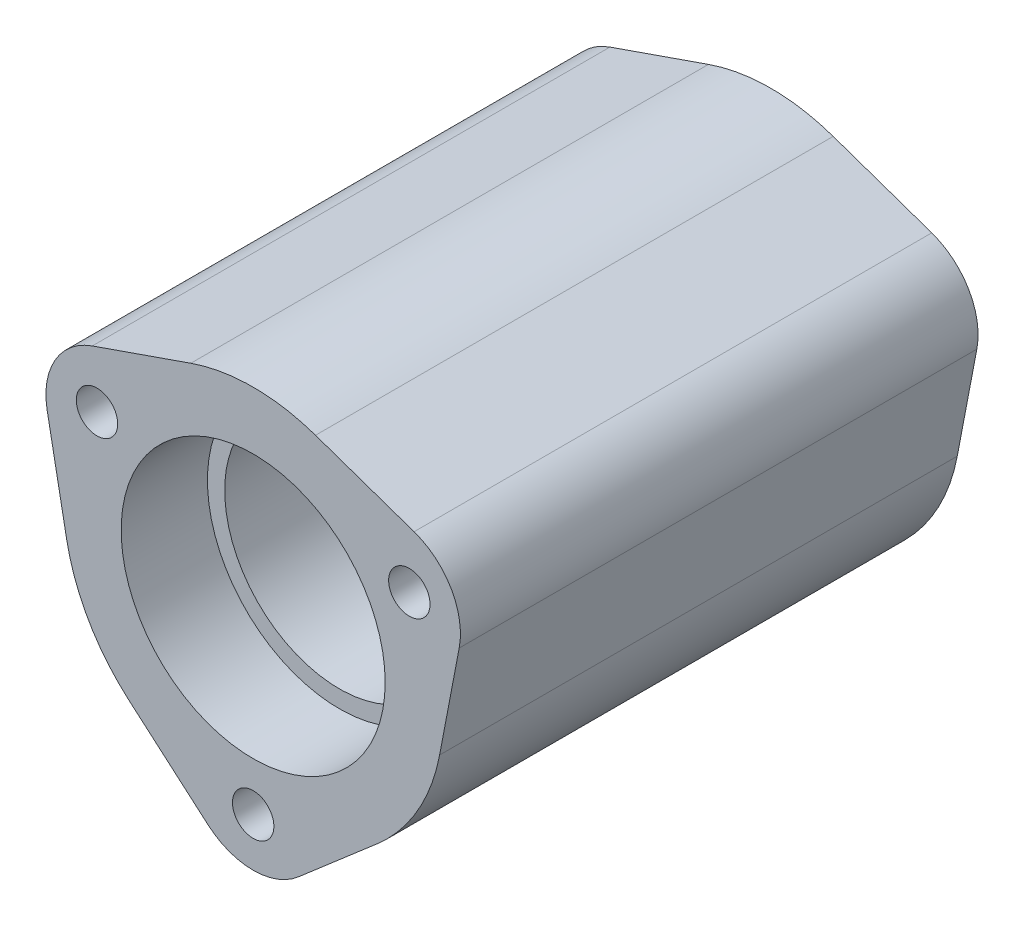
from build123d import *

# Parameters (mm, degrees)
EXTRUDE_765_DEPTH      = 15
SKETCH_2_R             = 7.65
CUT_EXTRUDE_1097_DEPTH = 5
SKETCH_3_R             = 6.65
CUT_EXTRUDE_1239_DEPTH = 31.737928604
SKETCH_4_R             = 1.2
CUT_EXTRUDE_1730_DEPTH = 11


with BuildPart() as part:
    # Эскиз1 → Extrude 765 (new, symmetric)
    with BuildSketch(Plane.XY):
        with BuildLine():
            Line((-9.32482414, 8.402984872), (-3.613745176, 10.389458398))
            ThreePointArc((-3.613745176, 10.389458398), (0, 11), (3.613745176, 10.389458398))
            Line((3.613745176, 10.389458398), (9.32482414, 8.402984872))
            ThreePointArc((9.32482414, 8.402984872), (11.4748366, 6.625), (11.939610437, 3.874042155))
            Line((11.939610437, 3.874042155), (10.804407492, -2.065134074))
            ThreePointArc((10.804407492, -2.065134074), (9.526279442, -5.5), (7.190662316, -8.324324324))
            Line((7.190662316, -8.324324324), (2.614786297, -12.277027027))
            ThreePointArc((2.614786297, -12.277027027), (0, -13.25), (-2.614786297, -12.277027027))
            Line((-2.614786297, -12.277027027), (-7.190662316, -8.324324324))
            ThreePointArc((-7.190662316, -8.324324324), (-9.526279442, -5.5), (-10.804407492, -2.065134074))
            Line((-10.804407492, -2.065134074), (-11.939610437, 3.874042155))
            ThreePointArc((-11.939610437, 3.874042155), (-11.4748366, 6.625), (-9.32482414, 8.402984872))
        make_face()
    extrude(amount=EXTRUDE_765_DEPTH, both=True)

    # Эскиз2 → Cut-Extrude 1097 (cut)
    with BuildSketch(Plane.XY.offset(15)):
        Circle(SKETCH_2_R)
    cut_extrude_1097 = extrude(amount=-CUT_EXTRUDE_1097_DEPTH, mode=Mode.SUBTRACT)

    # Mirror 1139: Cut-Extrude 1097 across plane
    add(cut_extrude_1097.mirror(Plane.XY), mode=Mode.SUBTRACT)

    # Эскиз3 → Cut-Extrude 1239 (cut, through all)
    with BuildSketch(Plane.XY.offset(10)):
        Circle(SKETCH_3_R)
    extrude(amount=-CUT_EXTRUDE_1239_DEPTH, mode=Mode.SUBTRACT)

    # Эскиз4 → Cut-Extrude 1730 (cut)
    with BuildSketch(Plane.XY.offset(15)):
        with Locations((-9.04996547, 5.225)):
            Circle(SKETCH_4_R)
        with Locations((0, -10.45)):
            Circle(SKETCH_4_R)
        with Locations((9.04996547, 5.225)):
            Circle(SKETCH_4_R)
    cut_extrude_1730 = extrude(amount=-CUT_EXTRUDE_1730_DEPTH, mode=Mode.SUBTRACT)

    # Mirror 1774: Cut-Extrude 1730 across plane
    add(cut_extrude_1730.mirror(Plane.XY), mode=Mode.SUBTRACT)


solid = part.part
